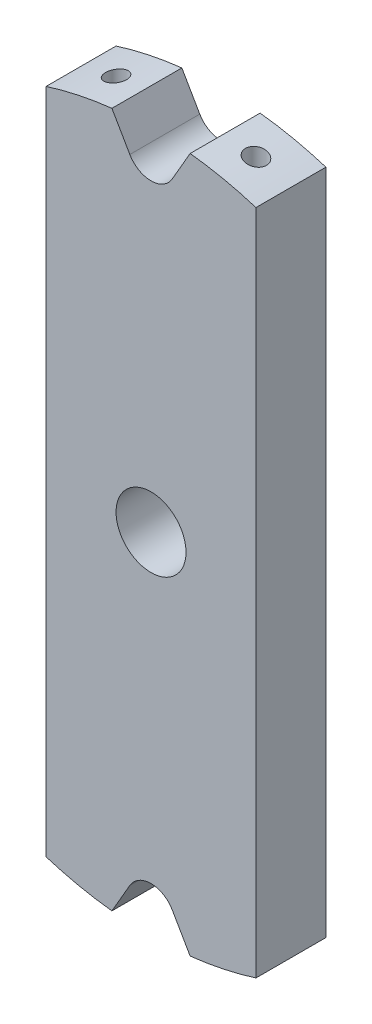
from build123d import *

# Parameters (mm, degrees)
EXTRUDE_1_DEPTH          = 10
CUT_EXTRUDE_1_DEPTH      = 53.855703508
CUT_EXTRUDE_1_DEPTH_BACK = 53.855703508
SKETCH_2_R               = 1.5
CUT_EXTRUDE_2_DEPTH      = 53.855703649
CUT_EXTRUDE_2_DEPTH_BACK = 53.855703649
SKETCH_3_R               = 5


with BuildPart() as part:
    # 草图1 → 凸台-拉伸1 (new body)
    with BuildSketch(Plane.XY):
        with BuildLine():
            ThreePointArc((-5.592370399, 49.686269666), (-10.344117547, 48.918291386), (-15, 47.696960071))
            Line((-15, 47.696960071), (-15, -47.696960071))
            ThreePointArc((-15, -47.696960071), (-10.344117547, -48.918291386), (-5.592370399, -49.686269666))
            Line((-5.592370399, -49.686269666), (-3.031088913, -45.25))
            ThreePointArc((-3.031088913, -45.25), (0, -43.5), (3.031088913, -45.25))
            Line((3.031088913, -45.25), (5.592370399, -49.686269666))
            ThreePointArc((5.592370399, -49.686269666), (10.344117547, -48.918291386), (15, -47.696960071))
            Line((15, -47.696960071), (15, 47.696960071))
            ThreePointArc((15, 47.696960071), (10.344117547, 48.918291386), (5.592370399, 49.686269666))
            Line((5.592370399, 49.686269666), (3.031088913, 45.25))
            ThreePointArc((3.031088913, 45.25), (0, 43.5), (-3.031088913, 45.25))
            Line((-3.031088913, 45.25), (-5.592370399, 49.686269666))
        make_face()
    extrude(amount=EXTRUDE_1_DEPTH)

    # 草图2 → 切除-拉伸1 (cut, two sides: drawn at the far end of the back side and taken through both)
    with BuildSketch(Plane(origin=(0, 0, 0), x_dir=(1, 0, 0), z_dir=(0, 1, 0)).offset(-CUT_EXTRUDE_1_DEPTH_BACK)):
        with Locations((-10, -5)):
            Circle(SKETCH_2_R)
        with Locations((10, -5)):
            Circle(SKETCH_2_R)
    extrude(amount=CUT_EXTRUDE_1_DEPTH + CUT_EXTRUDE_1_DEPTH_BACK, mode=Mode.SUBTRACT)

    # 草图3 → 切除-拉伸2 (cut, two sides: drawn at the far end of the back side and taken through both)
    with BuildSketch(Plane.XY.offset(10).offset(-CUT_EXTRUDE_2_DEPTH_BACK)):
        Circle(SKETCH_3_R)
    extrude(amount=CUT_EXTRUDE_2_DEPTH + CUT_EXTRUDE_2_DEPTH_BACK, mode=Mode.SUBTRACT)


solid = part.part
